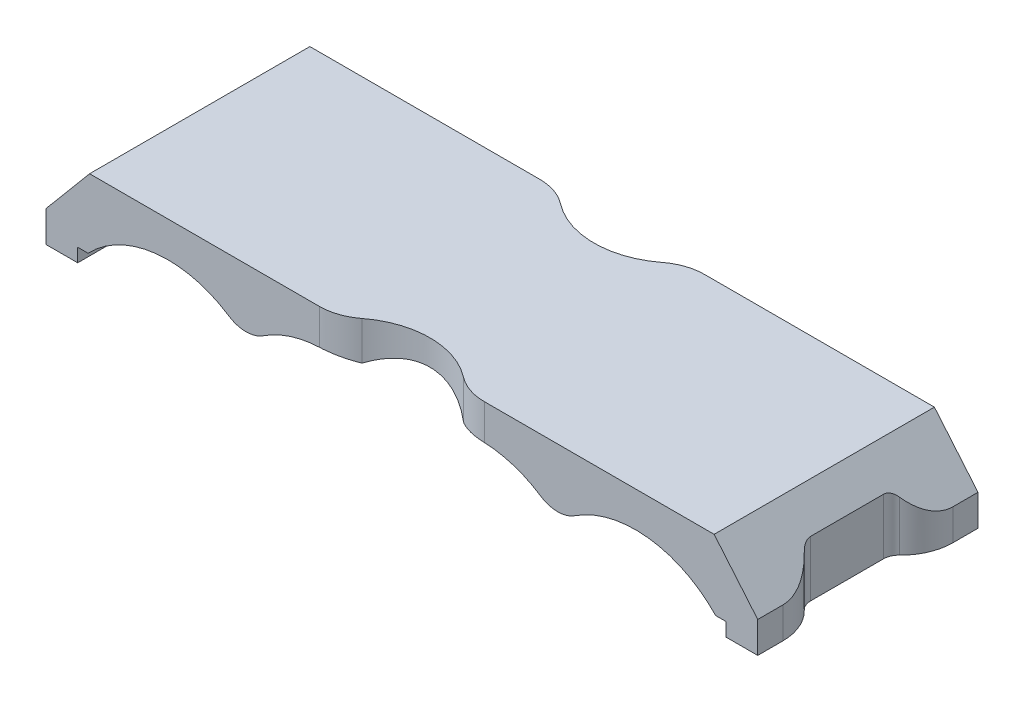
from build123d import *
from OCP.BRepFilletAPI import BRepFilletAPI_MakeChamfer

# Parameters (mm, degrees)
BOSS_EXTRUDE2_DEPTH = 21.2
CHAMFER1_SIZE       = 5
CHAMFER1_SIZE2      = 4.195498156
CUT_EXTRUDE1_DEPTH  = 42.067048835
FILLET2_R           = 5
FILLET3_R           = 3
CUT_EXTRUDE2_DEPTH  = 42.067048989
FILLET4_R           = 5
CUT_EXTRUDE3_DEPTH  = 42.067048989


with BuildPart() as part:
    # Sketch4 → Boss-Extrude2 (new body)
    with BuildSketch(Plane.XY):
        with BuildLine():
            Line((-34.25, 0), (34.25, 0))
            Line((34.25, 0), (34.25, -8))
            Line((34.25, -8), (31.2, -8))
            Line((31.2, -8), (31.2, -6.7))
            Line((31.2, -6.7), (30.2, -6.7))
            ThreePointArc((30.2, -6.7), (22.642993845, -3.400961512), (15, -6.49557652))
            ThreePointArc((15, -6.49557652), (7.5, -3.4), (0, -6.49557652))
            ThreePointArc((0, -6.49557652), (-7.5, -3.4), (-15, -6.49557652))
            ThreePointArc((-15, -6.49557652), (-22.642993845, -3.400961512), (-30.2, -6.7))
            Line((-30.2, -6.7), (-31.2, -6.7))
            Line((-31.2, -6.7), (-31.2, -8))
            Line((-31.2, -8), (-34.25, -8))
            Line((-34.25, -8), (-34.25, 0))
        make_face()
    extrude(amount=BOSS_EXTRUDE2_DEPTH)

    # Chamfer1: one chamfer whose edges measure the first distance from different faces: ONE call of the kernel's chamfer builder (chamfer() names one face for all edges)
    chamfer1_edges_1 = [part.edges().sort_by_distance(p)[0] for p in [
        (-34.25, 0, 10.6),
    ]]
    chamfer1_side_1 = [part.faces().sort_by_distance(p)[0] for p in [
        (-34.25, -4, 10.6),
    ]]
    chamfer1_edges_2 = [part.edges().sort_by_distance(p)[0] for p in [
        (34.25, 0, 10.6),
    ]]
    chamfer1_side_2 = [part.faces().sort_by_distance(p)[0] for p in [
        (34.25, -4, 10.6),
    ]]
    chamfer1 = BRepFilletAPI_MakeChamfer(part.part.solid().wrapped)
    for e in chamfer1_edges_1:
        chamfer1.Add(CHAMFER1_SIZE, CHAMFER1_SIZE2, e.wrapped, chamfer1_side_1[0].wrapped)  # the first distance lies on this face
    for e in chamfer1_edges_2:
        chamfer1.Add(CHAMFER1_SIZE, CHAMFER1_SIZE2, e.wrapped, chamfer1_side_2[0].wrapped)  # the first distance lies on this face
    add(Compound.cast(chamfer1.Shape()), mode=Mode.REPLACE)

    # Sketch5 → Cut-Extrude1 (cut, through all)
    with BuildSketch(Plane(origin=(0, 0, 0), x_dir=(1, 0, 0), z_dir=(0, 1, 0))):
        with BuildLine():
            Line((-6, 0), (6, 0))
            ThreePointArc((6, 0), (0, -2.708497378), (-6, 0))
        make_face()
        with BuildLine():
            Line((-6, -21.2), (6, -21.2))
            ThreePointArc((6, -21.2), (0, -18.491502622), (-6, -21.2))
        make_face()
    extrude(amount=-CUT_EXTRUDE1_DEPTH, mode=Mode.SUBTRACT)

    # Fillet2
    fillet2_edges = [part.edges().sort_by_distance(p)[0] for p in [
        (6, -1.753165508, 21.2),
        (-6, -1.753165508, 21.2),
        (-6, -1.753165508, 0),
        (6, -1.753165508, 0),
    ]]
    fillet(fillet2_edges, radius=FILLET2_R)

    # Fillet3
    fillet3_edges = [part.edges().sort_by_distance(p)[0] for p in [
        (-15, -6.49557652, 10.6),
        (0, -6.49557652, 10.6),
        (15, -6.49557652, 10.6),
    ]]
    fillet(fillet3_edges, radius=FILLET3_R)

    # Sketch6 → Cut-Extrude2 (cut, through all)
    with BuildSketch(Plane(origin=(0, 0, 0), x_dir=(1, 0, 0), z_dir=(0, 1, 0))):
        with BuildLine():
            Line((34.25, -5.6), (33.75, -5.6))
            ThreePointArc((33.75, -5.6), (32.689339828, -6.039339828), (32.25, -7.1))
            Line((32.25, -7.1), (32.25, -14.1))
            ThreePointArc((32.25, -14.1), (32.689339828, -15.160660172), (33.75, -15.6))
            Line((33.75, -15.6), (34.25, -15.6))
            Line((34.25, -15.6), (34.25, -5.6))
        make_face()
        with BuildLine():
            Line((-32.25, -7.1), (-32.25, -14.1))
            ThreePointArc((-32.25, -14.1), (-32.689339828, -15.160660172), (-33.75, -15.6))
            Line((-33.75, -15.6), (-34.25, -15.6))
            Line((-34.25, -15.6), (-34.25, -5.6))
            Line((-34.25, -5.6), (-33.75, -5.6))
            ThreePointArc((-33.75, -5.6), (-32.689339828, -6.039339828), (-32.25, -7.1))
        make_face()
    extrude(amount=-CUT_EXTRUDE2_DEPTH, mode=Mode.SUBTRACT)

    # Fillet4
    # the kernel refuses this fillet: 5 mm, written as the material it takes off along each edge
    with BuildSketch(Plane(origin=(-34.25, 2.9760394, 15.6), x_dir=(0, 0, 1), z_dir=(0, -1, 0)), Plane(origin=(34.25, 2.9760394, 5.6), x_dir=(0, 0, -1), z_dir=(0, -1, 0))) as fillet4_piece_1:
        with BuildLine():
            CenterArc((3.19041576, -5), FILLET4_R, 90, 46.18693854)
            Line((-0.417596363, -1.538461538), (-0.778397575, -1.192307692))
            ThreePointArc((-0.778397575, -1.192307692), (-0.5, -0.5), (-0.5, 0))
            Line((-0.5, 0), (0, 0.5))
            Line((0, 0.5), (3.19041576, 0.5))
            Line((3.19041576, 0.5), (3.19041576, 0))
        make_face()
    extrude(amount=18.952078799, mode=Mode.SUBTRACT)
    with BuildSketch(Plane(origin=(-34.25, 2.9760394, 5.6), x_dir=(0, 0, -1), z_dir=(0, -1, 0)), Plane(origin=(34.25, 2.9760394, 15.6), x_dir=(0, 0, 1), z_dir=(0, -1, 0))) as fillet4_piece_2:
        with BuildLine():
            CenterArc((3.19041576, 5), FILLET4_R, 223.81306146, 46.18693854)
            Line((-0.417596363, 1.538461538), (-0.778397575, 1.192307692))
            ThreePointArc((-0.778397575, 1.192307692), (-0.5, 0.5), (-0.5, 0))
            Line((-0.5, 0), (0, -0.5))
            Line((0, -0.5), (3.19041576, -0.5))
            Line((3.19041576, -0.5), (3.19041576, 0))
        make_face()
    extrude(amount=18.952078799, mode=Mode.SUBTRACT)

    # Sketch7 → Cut-Extrude3 (cut, through all)
    with BuildSketch(Plane.XY):
        with BuildLine():
            ThreePointArc((-4.887756907, -3.725862072), (0, -2.449957006), (4.887756907, -3.725862072))
            ThreePointArc((4.887756907, -3.725862072), (3.209259906, -4.304133612), (1.650366748, -5.153605376))
            ThreePointArc((1.650366748, -5.153605376), (0, -5.648352974), (-1.650366748, -5.153605376))
            ThreePointArc((-1.650366748, -5.153605376), (-3.209259906, -4.304133612), (-4.887756907, -3.725862072))
        make_face()
    extrude(amount=CUT_EXTRUDE3_DEPTH, mode=Mode.SUBTRACT)


solid = part.part
